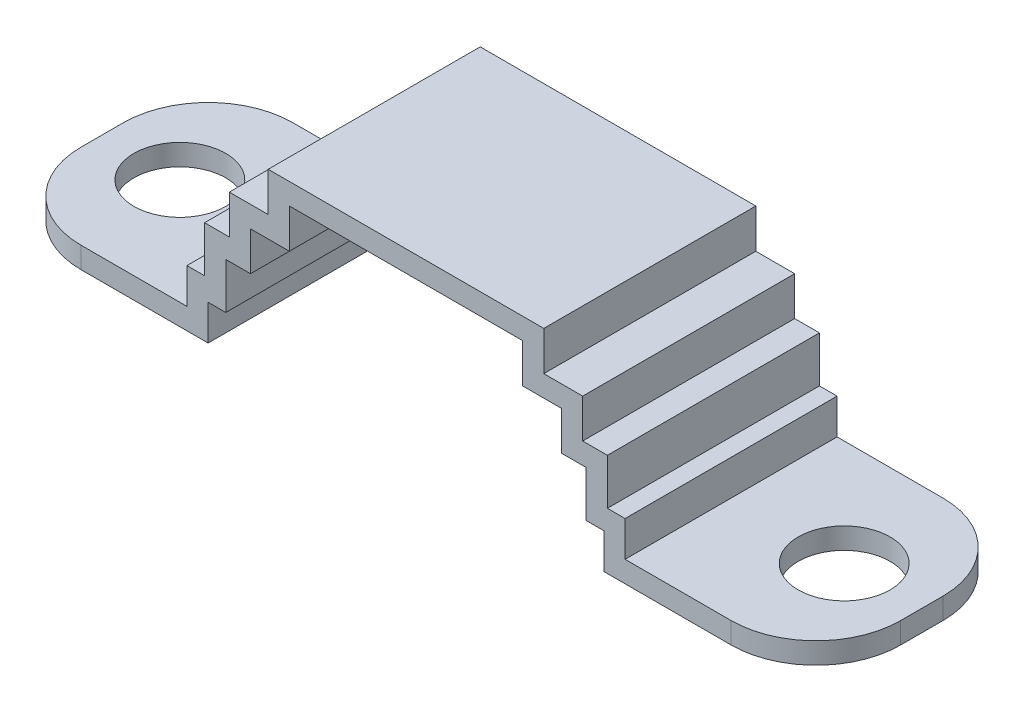
from build123d import *

# Parameters (mm, degrees)
EXTRUDE_THIN1_DEPTH  = 15
SKETCH2_R            = 6.5
CUT_EXTRUDE1_DEPTH   = 65.011737205
FILLET1_R            = 12
FILLET1_OF_MIRROR1_R = 12


with BuildPart() as part:
    # Sketch1 → Extrude-Thin1 (new, symmetric)
    with BuildSketch(Plane.XY):
        Polygon((-58, 4.5), (-28, 4.5), (-28, 9.5), (-25.5, 9.5), (-25.5, 16), (-22, 16), (-22, 21.5), (-16.5, 21.5), (-16.5, 27.05), (0, 27.05), (0, 30.05), (-19.5, 30.05), (-19.5, 24.5), (-25, 24.5), (-25, 19), (-28.5, 19), (-28.5, 12.5), (-31, 12.5), (-31, 7.5), (-58, 7.5), align=None)
    extrude_thin1 = extrude(amount=EXTRUDE_THIN1_DEPTH, both=True)

    # Sketch2 → Cut-Extrude1 (cut, through all)
    with BuildSketch(Plane(origin=(0, 7.5, 0), x_dir=(1, 0, 0), z_dir=(0, 1, 0))):
        with Locations((-47, 0)):
            Circle(SKETCH2_R)
    cut_extrude1 = extrude(amount=-CUT_EXTRUDE1_DEPTH, mode=Mode.SUBTRACT)

    # Fillet1
    fillet1_edges = [part.edges().sort_by_distance(p)[0] for p in [
        (-58, 6, -15),
        (-58, 6, 15),
    ]]
    fillet(fillet1_edges, radius=FILLET1_R)

    # Mirror1: Extrude-Thin1, Cut-Extrude1 across plane
    add(extrude_thin1.mirror(Plane(origin=(0, 30.05, 15), x_dir=(0, 0, 1), z_dir=(1, 0, 0))))
    add(cut_extrude1.mirror(Plane(origin=(0, 30.05, 15), x_dir=(0, 0, 1), z_dir=(1, 0, 0))), mode=Mode.SUBTRACT)

    # Fillet1 of Mirror1
    fillet1_of_mirror1_edges = [part.edges().sort_by_distance(p)[0] for p in [
        (58, 6, -15),
        (58, 6, 15),
    ]]
    fillet(fillet1_of_mirror1_edges, radius=FILLET1_OF_MIRROR1_R)


solid = part.part
